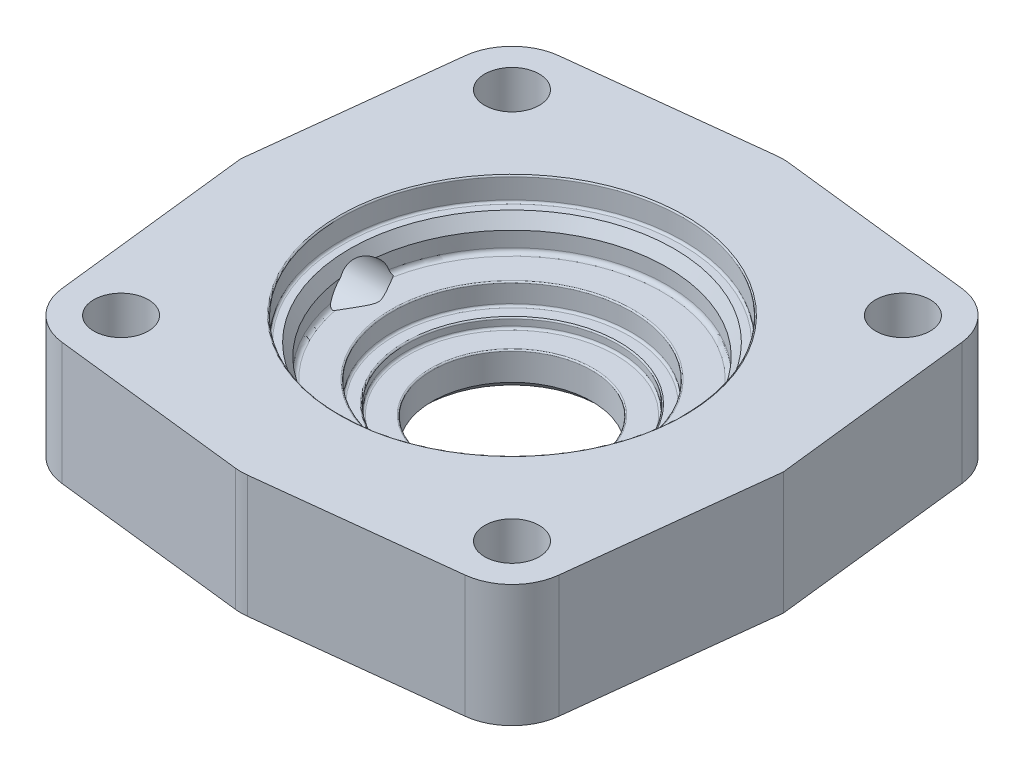
from build123d import *

# Parameters (mm, degrees)
BOSS_EXTRUDE1_DEPTH = 11.5
SKETCH5_R           = 5.125
CUT_EXTRUDE3_DEPTH  = 76.659834992
SKETCH4_R           = 44
SKETCH4_R_2         = 41.45
CUT_EXTRUDE2_DEPTH  = 1.75
FILLET1_R           = 0.25


with BuildPart() as part:
    # Sketch2 → Boss-Extrude1 (new, symmetric)
    with BuildSketch(Plane(origin=(0, 0, 0), x_dir=(1, 0, 0), z_dir=(0, 1, 0))):
        with BuildLine():
            Line((1.131558067, 50.871129935), (37.881558067, 46.685772559))
            ThreePointArc((37.881558067, 46.685772559), (43.821067812, 43.821067812), (46.685772559, 37.881558067))
            Line((46.685772559, 37.881558067), (51, 0))
            Line((51, 0), (46.685772559, -37.881558067))
            ThreePointArc((46.685772559, -37.881558067), (43.821067812, -43.821067812), (37.881558067, -46.685772559))
            Line((37.881558067, -46.685772559), (1.131558067, -50.871129935))
            ThreePointArc((1.131558067, -50.871129935), (0, -50.935357376), (-1.131558067, -50.871129935))
            Line((-1.131558067, -50.871129935), (-37.881558067, -46.685772559))
            ThreePointArc((-37.881558067, -46.685772559), (-43.821067812, -43.821067812), (-46.685772559, -37.881558067))
            Line((-46.685772559, -37.881558067), (-51, 0))
            Line((-51, 0), (-46.685772559, 37.881558067))
            ThreePointArc((-46.685772559, 37.881558067), (-43.821067812, 43.821067812), (-37.881558067, 46.685772559))
            Line((-37.881558067, 46.685772559), (-1.131558067, 50.871129935))
            ThreePointArc((-1.131558067, 50.871129935), (0, 50.935357376), (1.131558067, 50.871129935))
        make_face()
    extrude(amount=BOSS_EXTRUDE1_DEPTH, both=True)

    # Sketch5 → Cut-Extrude3 (cut, through all)
    with BuildSketch(Plane.XZ.offset(11.5)):
        with Locations((-36.75, 36.75)):
            Circle(SKETCH5_R)
        with Locations((36.75, 36.75)):
            Circle(SKETCH5_R)
        with Locations((-36.75, -36.75)):
            Circle(SKETCH5_R)
        with Locations((36.75, -36.75)):
            Circle(SKETCH5_R)
    extrude(amount=-CUT_EXTRUDE3_DEPTH, mode=Mode.SUBTRACT)

    # Sketch4 → Cut-Extrude2 (cut)
    with BuildSketch(Plane.XZ.offset(11.5)):
        Circle(SKETCH4_R)
        Circle(SKETCH4_R_2, mode=Mode.SUBTRACT)
    extrude(amount=-CUT_EXTRUDE2_DEPTH, mode=Mode.SUBTRACT)

    # Sketch6 → Cut-Revolve1 (revolve, cut)
    with BuildSketch(Plane(origin=(0, 0, 0), x_dir=(0, 0, -1), z_dir=(1, 0, 0))):
        with BuildLine():
            Line((32.25, 11.5), (32.25, 7.5))
            ThreePointArc((32.25, 7.5), (32.132842712, 7.217157288), (31.85, 7.1))
            Line((31.85, 7.1), (30.5, 7.1))
            Line((30.5, 7.1), (29.15, 4.76173141))
            Line((29.15, 4.76173141), (29.15, 1.9))
            ThreePointArc((29.15, 1.9), (28.915685425, 1.334314575), (28.35, 1.1))
            Line((28.35, 1.1), (22.75, 1.1))
            ThreePointArc((22.75, 1.1), (22.573223305, 1.026776695), (22.5, 0.85))
            Line((22.5, 0.85), (22.5, -2.5))
            ThreePointArc((22.5, -2.5), (22.382842712, -2.782842712), (22.1, -2.9))
            Line((22.1, -2.9), (20.15, -2.9))
            ThreePointArc((20.15, -2.9), (19.973223305, -2.973223305), (19.9, -3.15))
            Line((19.9, -3.15), (19.9, -4.3))
            ThreePointArc((19.9, -4.3), (19.782842712, -4.582842712), (19.5, -4.7))
            Line((19.5, -4.7), (15.25, -4.7))
            ThreePointArc((15.25, -4.7), (15.073223305, -4.773223305), (15, -4.95))
            Line((15, -4.95), (15, -10))
            Line((15, -10), (16.5, -11.5))
            Line((16.5, -11.5), (0, -11.5))
            Line((0, -11.5), (0, 11.5))
            Line((0, 11.5), (32.25, 11.5))
        make_face()
    revolve(axis=Axis((0, 16.721250206, 0), (0, -1, 0)), mode=Mode.SUBTRACT)

    # Fillet1
    fillet1_edges = [part.edges().sort_by_distance(p)[0] for p in [
        (0, 11.5, 32.25),
    ]]
    fillet(fillet1_edges, radius=FILLET1_R)

    # Sketch7 → Cut-Revolve2 (revolve, cut)
    with BuildSketch(Plane.XY):
        Polygon((-52.009628693, 10), (-49.5, 10), (-49.5, 5.8), (-27.98499159, 5.8), (-24.5, 0), (-52.009628693, 0), align=None)
    revolve(axis=Axis((-52.009628693, 0, 0), (1, 0, 0)), mode=Mode.SUBTRACT)

    # Sketch9 → Cut-Revolve3 (revolve, cut)
    with BuildSketch(Plane.XY):
        Polygon((26.468244231, 7.953971651), (24.303180721, 6.703971651), (37.448959942, -16.065185865), (39.614023451, -14.815185865), align=None)
    revolve(axis=Axis((26.468244231, 7.953971651, 0), (0.49999999999999484, -0.8660254037844416, 0)), mode=Mode.SUBTRACT)


solid = part.part
